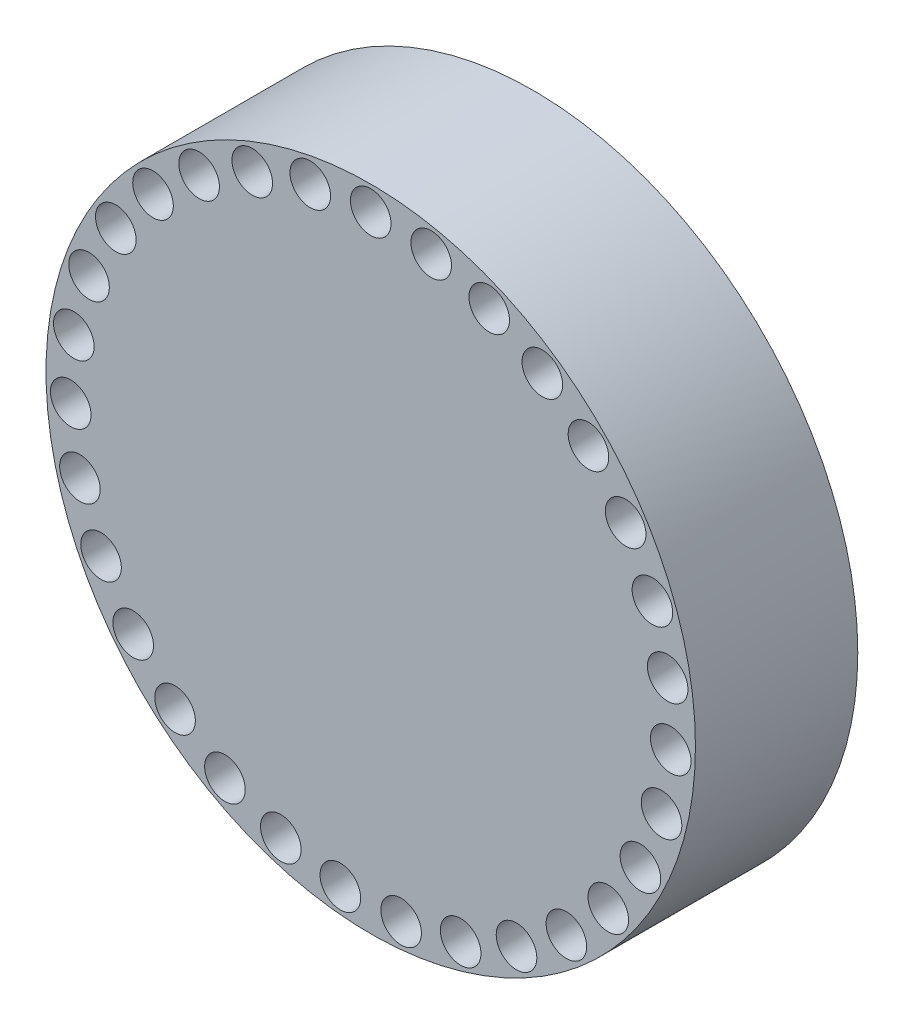
from build123d import *

# Parameters (mm, degrees)
SKETCH1_R           = 50.8
BOSS_EXTRUDE1_DEPTH = 25.4
SKETCH2_R           = 3.175
CUT_EXTRUDE1_DEPTH  = 77.2
CIRPATTERN1_COUNT   = 31


with BuildPart() as part:
    # Sketch1 → Boss-Extrude1 (new body)
    with BuildSketch(Plane.XY):
        Circle(SKETCH1_R)
    extrude(amount=BOSS_EXTRUDE1_DEPTH)

    # Sketch2 → Cut-Extrude1 (cut, through all)
    with BuildSketch(Plane.XY.offset(25.4)):
        with Locations((0, 46.9944704)):
            Circle(SKETCH2_R)
    cut_extrude1 = extrude(amount=-CUT_EXTRUDE1_DEPTH, mode=Mode.SUBTRACT)

    # CirPattern1: Cut-Extrude1 ×31 about axis
    cirpattern1_axis = Axis((0, 0, 25.4), (0, 0, -1))
    for i in range(1, CIRPATTERN1_COUNT):
        add(cut_extrude1.rotate(cirpattern1_axis, i * 360 / CIRPATTERN1_COUNT), mode=Mode.SUBTRACT)


solid = part.part
